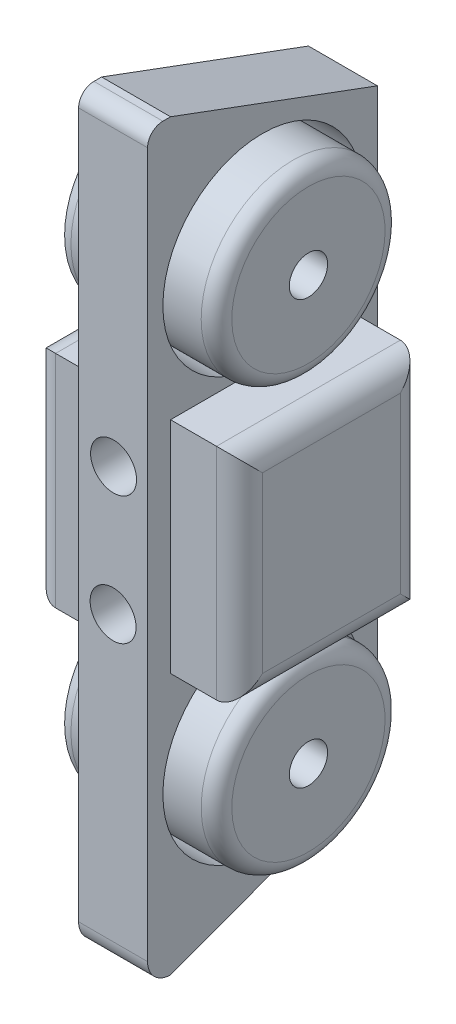
from build123d import *

# Parameters (mm, degrees)
SKETCH1_W            = 9
SKETCH1_H            = 100
BOSS_EXTRUDE1_DEPTH  = 3
FILLET1_R            = 3
SKETCH2_W            = 3
SKETCH2_H            = 3
CUT_EXTRUDE1_DEPTH   = 13
SKETCH3_W            = 27
SKETCH3_H            = 97
BOSS_EXTRUDE2_DEPTH  = 9
CUT_EXTRUDE2_DEPTH   = 9
BOSS_EXTRUDE5_DEPTH  = 6
BOSS_EXTRUDE6_START  = 6
BOSS_EXTRUDE6_DEPTH  = 6
SKETCH9_R            = 2.5
CUT_EXTRUDE3_DEPTH   = 46
CUT_EXTRUDE4_START   = -46
SKETCH10_R           = 13
SKETCH10_R_2         = 12
CUT_EXTRUDE4_DEPTH   = 46
SKETCH11_W           = 30
SKETCH11_H           = 14.252212687
SKETCH11_H_2         = 14.52282432
BOSS_EXTRUDE7_DEPTH  = 6
SKETCH12_W           = 30
SKETCH12_H           = 12.752212687
SKETCH12_H_2         = 15.932620442
BOSS_EXTRUDE8_DEPTH  = 6
SKETCH13_W           = 3
SKETCH13_H           = 28.684833129
CUT_EXTRUDE5_DEPTH   = 6
SKETCH14_W           = 3
SKETCH14_H           = 28.775037007
CUT_EXTRUDE6_DEPTH   = 6
SKETCH15_W           = 24
SKETCH15_H           = 28.775037007
BOSS_EXTRUDE9_DEPTH  = 3
SKETCH16_W           = 24
SKETCH16_H           = 28.684833129
BOSS_EXTRUDE10_DEPTH = 3
FILLET2_R            = 2
FILLET3_R            = 2
FILLET4_R            = 2
SKETCH18_R           = 3
CUT_EXTRUDE7_DEPTH   = 40
FILLET5_R            = 3


with BuildPart() as part:
    # Sketch1 → Boss-Extrude1 (new body)
    with BuildSketch(Plane.XY):
        with Locations((4.5, 50)):
            Rectangle(SKETCH1_W, SKETCH1_H)
    extrude(amount=BOSS_EXTRUDE1_DEPTH)

    # Fillet1
    fillet1_edges = [part.edges().sort_by_distance(p)[0] for p in [
        (4.5, 0, 3),
        (4.5, 100, 3),
    ]]
    fillet(fillet1_edges, radius=FILLET1_R - 0.0001)  # a hair under: the kernel refuses the full size

    # Sketch2 → Cut-Extrude1 (cut)
    with BuildSketch(Plane(origin=(9, 0, 0), x_dir=(0, 0, -1), z_dir=(1, 0, 0))):
        with Locations((-1.5, 98.5)):
            Rectangle(SKETCH2_W, SKETCH2_H)
    extrude(amount=-CUT_EXTRUDE1_DEPTH, mode=Mode.SUBTRACT)

    # Sketch3 → Boss-Extrude2 (add)
    with BuildSketch(Plane(origin=(9, 0, 0), x_dir=(0, 0, -1), z_dir=(1, 0, 0))):
        with Locations((13.5, 48.5)):
            Rectangle(SKETCH3_W, SKETCH3_H)
    extrude(amount=-BOSS_EXTRUDE2_DEPTH)

    # Sketch4 → Cut-Extrude2 (cut)
    with BuildSketch(Plane(origin=(9, 0, 0), x_dir=(0, 0, -1), z_dir=(1, 0, 0))):
        Polygon((27, 87), (27, 97), (0, 97), align=None)
        Polygon((27, 0), (27, 10), (0, 0), align=None)
    extrude(amount=-CUT_EXTRUDE2_DEPTH, mode=Mode.SUBTRACT)

    # Sketch7 → Boss-Extrude5 (add)
    with BuildSketch(Plane(origin=(9, 0, 0), x_dir=(0, 0, -1), z_dir=(1, 0, 0))):
        with BuildLine():
            ThreePointArc((3.514718626, 84.596392485), (0.91344561, 80.703312299), (0, 76.111111111))
            ThreePointArc((0, 76.111111111), (3.514718626, 67.625829737), (12, 64.111111111))
            ThreePointArc((12, 64.111111111), (16.592201188, 65.024556721), (20.485281374, 67.625829737))
            Line((20.485281374, 67.625829737), (3.514718626, 84.596392485))
        make_face()
        with BuildLine():
            ThreePointArc((24, 76.111111111), (20.485281374, 84.596392485), (12, 88.111111111))
            ThreePointArc((12, 88.111111111), (7.407798812, 87.197665501), (3.514718626, 84.596392485))
            Line((3.514718626, 84.596392485), (20.485281374, 67.625829737))
            ThreePointArc((20.485281374, 67.625829737), (23.08655439, 71.518909923), (24, 76.111111111))
        make_face()
        with BuildLine():
            ThreePointArc((12, 32.888888889), (3.514718621, 29.374170258), (0, 20.888888874))
            ThreePointArc((0, 20.888888874), (0.913445613, 16.296687694), (3.514718626, 12.403607515))
            Line((3.514718626, 12.403607515), (20.485281374, 29.374170263))
            ThreePointArc((20.485281374, 29.374170263), (16.592201188, 31.975443279), (12, 32.888888889))
        make_face()
        with BuildLine():
            ThreePointArc((12, 8.888888889), (20.485281374, 12.403607515), (24, 20.888888889))
            ThreePointArc((24, 20.888888889), (23.08655439, 25.481090077), (20.485281374, 29.374170263))
            Line((20.485281374, 29.374170263), (3.514718626, 12.403607515))
            ThreePointArc((3.514718626, 12.403607515), (7.407798812, 9.802334499), (12, 8.888888889))
        make_face()
    extrude(amount=BOSS_EXTRUDE5_DEPTH)

    # Sketch8 → Boss-Extrude6 (add)
    with BuildSketch(Plane.ZY.offset(BOSS_EXTRUDE6_START)):
        with BuildLine():
            ThreePointArc((-3.514718626, 67.625829737), (-0.91344561, 71.518909923), (0, 76.111111111))
            ThreePointArc((0, 76.111111111), (-3.514718626, 84.596392485), (-12, 88.111111111))
            ThreePointArc((-12, 88.111111111), (-16.592201188, 87.197665501), (-20.485281374, 84.596392485))
            Line((-20.485281374, 84.596392485), (-3.514718626, 67.625829737))
        make_face()
        with BuildLine():
            ThreePointArc((-12, 64.111111111), (-7.407798812, 65.024556721), (-3.514718626, 67.625829737))
            Line((-3.514718626, 67.625829737), (-20.485281374, 84.596392485))
            ThreePointArc((-20.485281374, 84.596392485), (-23.086554402, 80.703312271), (-24, 76.111111049))
            ThreePointArc((-24, 76.111111049), (-20.485281352, 67.625829715), (-12, 64.111111111))
        make_face()
        with BuildLine():
            ThreePointArc((-3.514718626, 12.403607515), (-0.91344561, 16.296687701), (0, 20.888888889))
            ThreePointArc((0, 20.888888889), (-3.514718626, 29.374170263), (-12, 32.888888889))
            ThreePointArc((-12, 32.888888889), (-16.592201188, 31.975443279), (-20.485281374, 29.374170263))
            Line((-20.485281374, 29.374170263), (-3.514718626, 12.403607515))
        make_face()
        with BuildLine():
            ThreePointArc((-11.999999953, 8.888888889), (-7.40779879, 9.802334508), (-3.514718626, 12.403607515))
            Line((-3.514718626, 12.403607515), (-20.485281374, 29.374170263))
            ThreePointArc((-20.485281374, 29.374170263), (-23.086554378, 25.481090106), (-24, 20.888888951))
            ThreePointArc((-24, 20.888888951), (-20.485281379, 12.40360752), (-11.999999953, 8.888888889))
        make_face()
    extrude(amount=-BOSS_EXTRUDE6_DEPTH)

    # Sketch9 → Cut-Extrude3 (cut)
    with BuildSketch(Plane.ZY.offset(6)):
        with Locations((-12, 76.111111111)):
            Circle(SKETCH9_R)
        with Locations((-12, 20.888888889)):
            Circle(SKETCH9_R)
    extrude(amount=-CUT_EXTRUDE3_DEPTH, mode=Mode.SUBTRACT)

    # Sketch10 → Cut-Extrude4 (cut)
    # profile 1 of 2: a face of its own
    with BuildSketch(Plane(origin=(15, 0, 0), x_dir=(0, 0, -1), z_dir=(1, 0, 0)).offset(CUT_EXTRUDE4_START)):
        with Locations(Location((12, 76.111111111, 0), (0, 0, 180))):
            Circle(SKETCH10_R)
        with Locations(Location((12, 76.111111111, 0), (0, 0, 180))):
            Circle(SKETCH10_R_2, mode=Mode.SUBTRACT)
    # profile 2 of 2: a face of its own
    with BuildSketch(Plane(origin=(15, 0, 0), x_dir=(0, 0, -1), z_dir=(1, 0, 0)).offset(CUT_EXTRUDE4_START)):
        with Locations(Location((12, 20.888888889, 0), (0, 0, 180))):
            Circle(SKETCH10_R)
        with Locations(Location((12, 20.888888889, 0), (0, 0, 90))):
            Circle(SKETCH10_R_2, mode=Mode.SUBTRACT)
    extrude(amount=CUT_EXTRUDE4_DEPTH, mode=Mode.SUBTRACT)


with BuildPart() as cut_extrude4_piece_1:
    # of the separate pieces the step leaves, piece 1, a body of its own (cut_extrude4_pieces)
    add(part.part.solids().sort_by_distance((0, 0, 0.0001))[0])

    # Sketch11 → Boss-Extrude7 (add)
    with BuildSketch(Plane.ZY):
        with Locations((-12, 55.626106343)):
            Rectangle(SKETCH11_W, SKETCH11_H)
        with Locations((-12, 41.23858784)):
            Rectangle(SKETCH11_W, SKETCH11_H_2)
    extrude(amount=BOSS_EXTRUDE7_DEPTH)

    # Sketch12 → Boss-Extrude8 (add)
    with BuildSketch(Plane(origin=(9, 0, 0), x_dir=(0, 0, -1), z_dir=(1, 0, 0))):
        with Locations((12, 56.376106343)):
            Rectangle(SKETCH12_W, SKETCH12_H)
        with Locations((12, 42.033689779)):
            Rectangle(SKETCH12_W, SKETCH12_H_2)
    extrude(amount=BOSS_EXTRUDE8_DEPTH)

    # Sketch13 → Cut-Extrude5 (cut)
    with BuildSketch(Plane(origin=(15, 0, 0), x_dir=(0, 0, -1), z_dir=(1, 0, 0))):
        with Locations((25.5, 48.409796122)):
            Rectangle(SKETCH13_W, SKETCH13_H)
        with Locations((-1.5, 48.409796122)):
            Rectangle(SKETCH13_W, SKETCH13_H)
    extrude(amount=-CUT_EXTRUDE5_DEPTH, mode=Mode.SUBTRACT)

    # Sketch14 → Cut-Extrude6 (cut)
    with BuildSketch(Plane.ZY.offset(6)):
        with Locations((1.5, 48.364694184)):
            Rectangle(SKETCH14_W, SKETCH14_H)
        with Locations((-25.5, 48.364694184)):
            Rectangle(SKETCH14_W, SKETCH14_H)
    extrude(amount=-CUT_EXTRUDE6_DEPTH, mode=Mode.SUBTRACT)

    # Sketch15 → Boss-Extrude9 (add, symmetric)
    with BuildSketch(Plane.ZY.offset(6)):
        with Locations((-12, 48.364694184)):
            Rectangle(SKETCH15_W, SKETCH15_H)
    extrude(amount=BOSS_EXTRUDE9_DEPTH, both=True)

    # Sketch16 → Boss-Extrude10 (add, symmetric)
    with BuildSketch(Plane(origin=(15, 0, 0), x_dir=(0, 0, -1), z_dir=(1, 0, 0))):
        with Locations((12, 48.409796122)):
            Rectangle(SKETCH16_W, SKETCH16_H)
    extrude(amount=BOSS_EXTRUDE10_DEPTH, both=True)

    # Fillet4
    fillet4_edges = [cut_extrude4_piece_1.edges().sort_by_distance(p)[0] for p in [
        (4.5, 97, 3),
    ]]
    fillet(fillet4_edges, radius=FILLET4_R)

    # Sketch18 → Cut-Extrude7 (cut)
    with BuildSketch(Plane.XY.offset(3)):
        with Locations((4.5, 40.022277619)):
            Circle(SKETCH18_R)
        with Locations((4.560135919, 56.752212687)):
            Circle(SKETCH18_R)
    extrude(amount=-CUT_EXTRUDE7_DEPTH, mode=Mode.SUBTRACT)

    # Fillet5
    fillet5_edges = [cut_extrude4_piece_1.edges().sort_by_distance(p)[0] for p in [
        (-9, 48.364694183, -24),
        (-9, 33.97717568, -12),
        (-9, 48.364694183, 0),
        (-9, 62.752212687, -12),
        (18, 48.409796122, 0),
        (18, 34.067379558, -12),
        (18, 48.409796122, -24),
        (18, 62.752212687, -12),
    ]]
    fillet(fillet5_edges, radius=FILLET5_R)


with BuildPart() as cut_extrude4_piece_2:
    # of the separate pieces the step leaves, piece 2, a body of its own (cut_extrude4_pieces)
    add(part.part.solids().sort_by_distance((-6, 84.596392485, -20.485281374))[0])

    # Fillet2
    fillet2_edges = [cut_extrude4_piece_2.edges().sort_by_distance(p)[0] for p in [
        (15, 71.518909923, -23.08655439),
        (-6, 87.197665501, -7.407798812),
    ]]
    fillet(fillet2_edges, radius=FILLET2_R)


with BuildPart() as cut_extrude4_piece_3:
    # of the separate pieces the step leaves, piece 3, a body of its own (cut_extrude4_pieces)
    add(part.part.solids().sort_by_distance((-6, 29.374170263, -20.485281374))[0])

    # Fillet3
    fillet3_edges = [cut_extrude4_piece_3.edges().sort_by_distance(p)[0] for p in [
        (-6, 9.802334499, -7.407798812),
        (15, 31.975443279, -16.592201188),
    ]]
    fillet(fillet3_edges, radius=FILLET3_R)


solid = Compound([cut_extrude4_piece_1.part, cut_extrude4_piece_2.part, cut_extrude4_piece_3.part])
